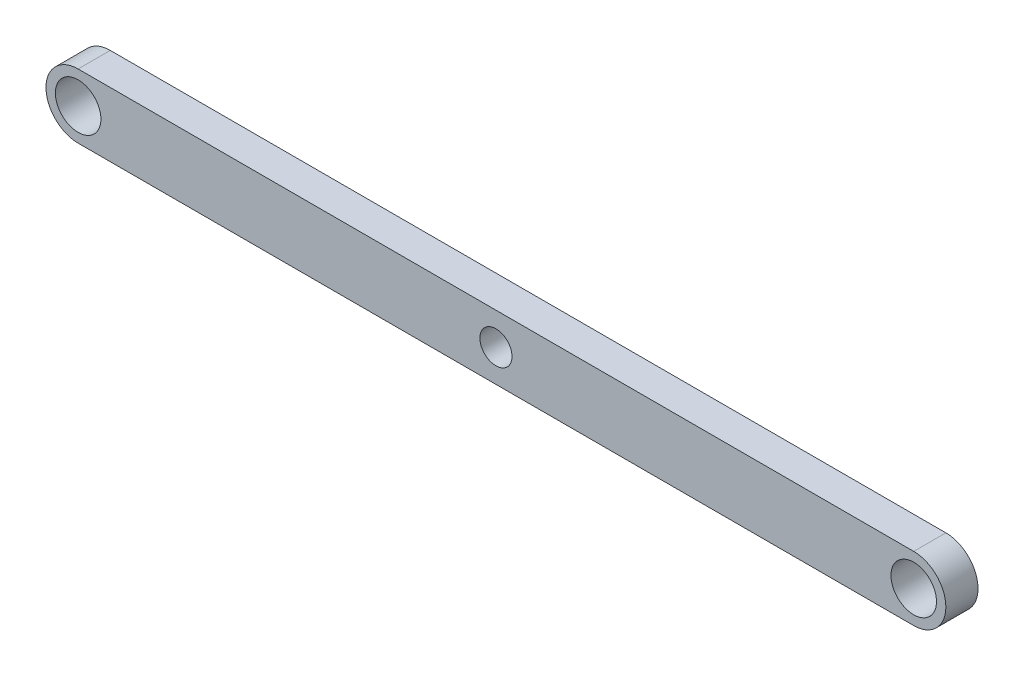
from build123d import *

# Parameters (mm, degrees)
SKETCH1_R           = 4.5
SKETCH1_R_2         = 3.175
BOSS_EXTRUDE1_DEPTH = 6.35


with BuildPart() as part:
    # Sketch1 → Boss-Extrude1 (new body)
    with BuildSketch(Plane.XY):
        with BuildLine():
            Line((-82.55, 6.35), (82.55, 6.35))
            ThreePointArc((82.55, 6.35), (88.9, 0), (82.55, -6.35))
            Line((82.55, -6.35), (-82.55, -6.35))
            ThreePointArc((-82.55, -6.35), (-88.9, 0), (-82.55, 6.35))
        make_face()
        with Locations((-82.55, 0)):
            Circle(SKETCH1_R, mode=Mode.SUBTRACT)
        with Locations((82.55, 0)):
            Circle(SKETCH1_R, mode=Mode.SUBTRACT)
        Circle(SKETCH1_R_2, mode=Mode.SUBTRACT)
    extrude(amount=BOSS_EXTRUDE1_DEPTH)


solid = part.part
